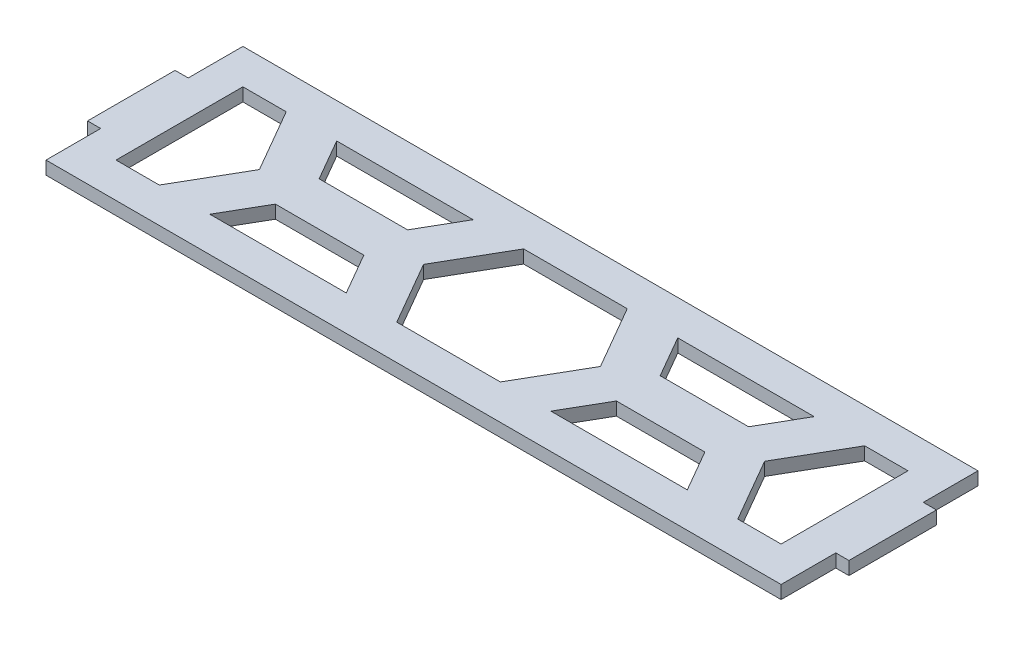
from build123d import *

# Parameters (mm, degrees)
BOSS_EXTRUDE1_DEPTH     = 1.5
CUT_EXTRUDE1_DEPTH      = 90.874913074
CUT_EXTRUDE1_DEPTH_BACK = 90.874913074


with BuildPart() as part:
    # Sketch1 → Boss-Extrude1 (new, symmetric)
    with BuildSketch(Plane(origin=(0, 0, 0), x_dir=(1, 0, 0), z_dir=(0, 1, 0))):
        Polygon((-87, 10), (-87, -10), (-84, -10), (-84, -22.5), (84, -22.5), (84, -10), (87, -10), (87, 10), (84, 10), (84, 22.5), (-84, 22.5), (-84, 10), align=None)
    extrude(amount=BOSS_EXTRUDE1_DEPTH, both=True)

    # Sketch3 → Cut-Extrude1 (cut, two sides: drawn at the far end of the back side and taken through both)
    with BuildSketch(Plane(origin=(0, 0, 0), x_dir=(1, 0, 0), z_dir=(0, 1, 0)).offset(-CUT_EXTRUDE1_DEPTH_BACK)):
        Polygon((-76, -14.5), (-66.106605822, -14.5), (-57.735026919, 0), (-66.106605822, 14.5), (-76, 14.5), align=None)
        Polygon((-49.074772881, -5), (-54.559600438, -14.5), (-23.382685902, -14.5), (-28.867513459, -5), align=None)
        Polygon((-23.382685902, 14.5), (-54.559600438, 14.5), (-49.074772881, 5), (-28.867513459, 5), align=None)
        Polygon((-20.207259422, 0), (-11.835680518, -14.5), (11.835680518, -14.5), (20.207259422, 0), (11.835680518, 14.5), (-11.835680518, 14.5), align=None)
        Polygon((28.867513459, -5), (23.382685902, -14.5), (54.559600438, -14.5), (49.074772881, -5), align=None)
        Polygon((54.559600438, 14.5), (23.382685902, 14.5), (28.867513459, 5), (49.074772881, 5), align=None)
        Polygon((57.735026919, 0), (66.106605822, -14.5), (76, -14.5), (76, 14.5), (66.106605822, 14.5), align=None)
    extrude(amount=CUT_EXTRUDE1_DEPTH + CUT_EXTRUDE1_DEPTH_BACK, mode=Mode.SUBTRACT)


solid = part.part
